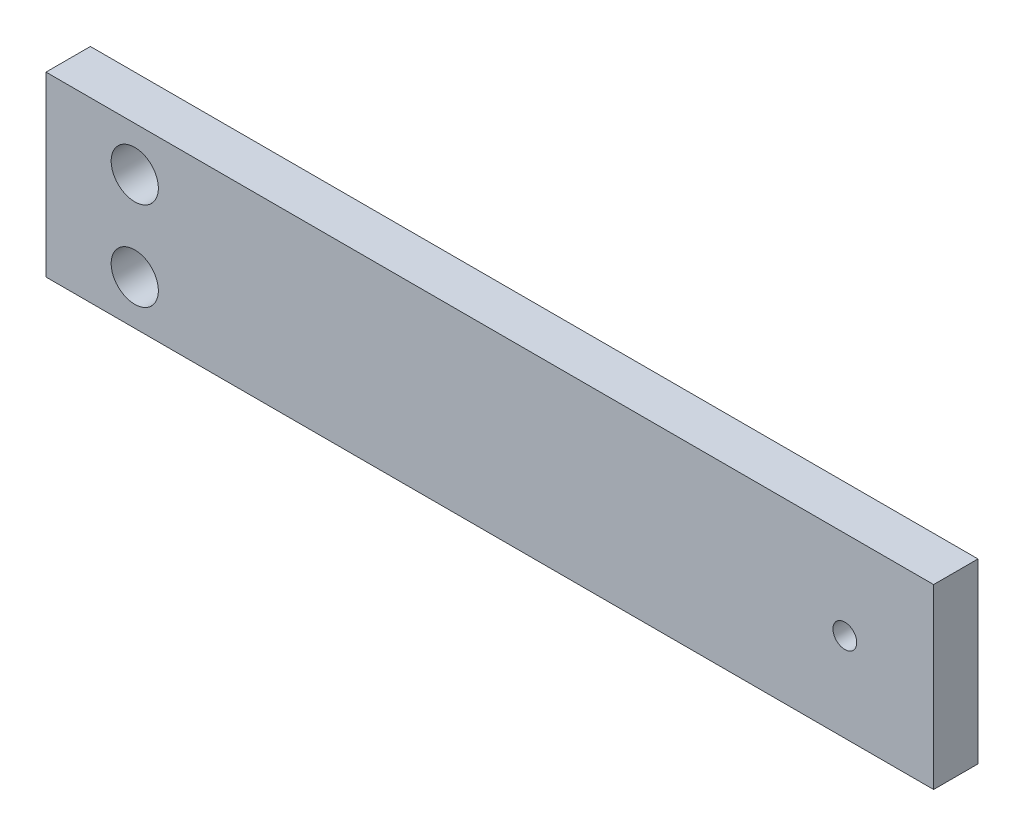
from build123d import *

# Parameters (mm, degrees)
SKETCH1_W               = 127
SKETCH1_H               = 25.4
BOSS_EXTRUDE1_DEPTH     = 6.35
F_1_4_CLEARANCE_HOLE1_D = 6.7564
M3_CLEARANCE_HOLE1_D    = 3.4


with BuildPart() as part:
    # Sketch1 → Boss-Extrude1 (new body)
    with BuildSketch(Plane.XY):
        with Locations((63.5, 12.7)):
            Rectangle(SKETCH1_W, SKETCH1_H)
    extrude(amount=BOSS_EXTRUDE1_DEPTH)

    # 1/4 Clearance Hole1 (through all)
    with Locations(Plane.XY.offset(6.35)):
        with Locations((12.7, 6.35), (12.7, 19.05)):
            Hole(F_1_4_CLEARANCE_HOLE1_D / 2)

    # M3 Clearance Hole1 (through all)
    with Locations(Plane.XY.offset(6.35)):
        with Locations((114.3, 12.7)):
            Hole(M3_CLEARANCE_HOLE1_D / 2)


solid = part.part
